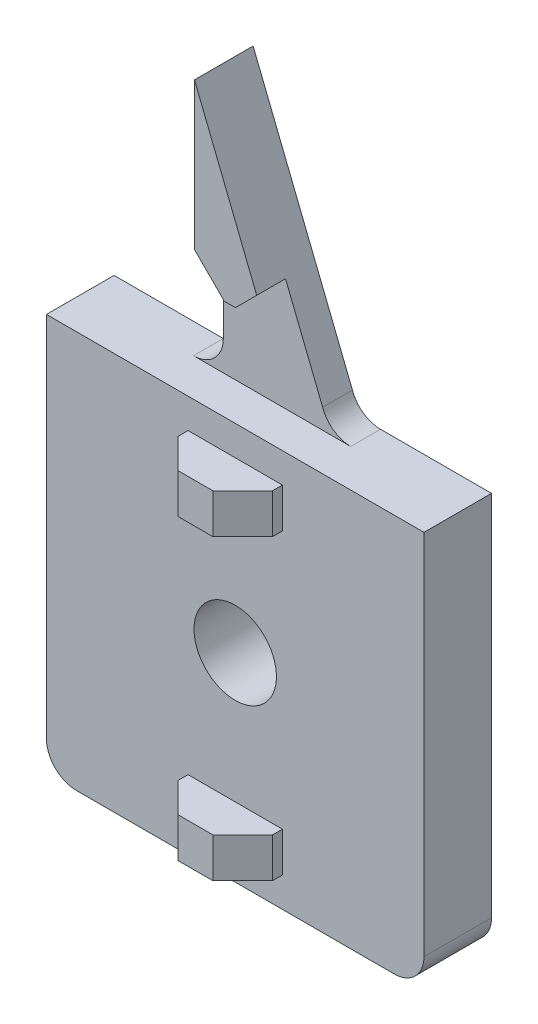
from build123d import *
from OCP.BRepFilletAPI import BRepFilletAPI_MakeChamfer

# Parameters (mm, degrees)
BOSS_EXTRUDE1_DEPTH      = 3.8
BOSS_EXTRUDE1_DEPTH_BACK = 3
SKETCH1_W                = 38
SKETCH1_H                = 40
SKETCH1_R                = 4.15
BOSS_EXTRUDE2_DEPTH      = 3
FILLET1_R                = 3
SKETCH3_W                = 9.5
SKETCH3_H                = 4
BOSS_EXTRUDE3_DEPTH      = 4
BOSS_EXTRUDE4_DEPTH      = 2.9
CHAMFER1_SIZE            = 3
CHAMFER1_SIZE2           = 2.307927774


with BuildPart() as part:
    # Sketch1 → Boss-Extrude1 (new, two sides: drawn at the far end of the back side and taken through both)
    with BuildSketch(Plane.XY.offset(-BOSS_EXTRUDE1_DEPTH_BACK)):
        Rectangle(SKETCH1_W, SKETCH1_H)
        with Locations(Location((0, 0, 0), (0, 0, 180))):
            Circle(SKETCH1_R, mode=Mode.SUBTRACT)
    extrude(amount=BOSS_EXTRUDE1_DEPTH + BOSS_EXTRUDE1_DEPTH_BACK)

    # Sketch2 → Boss-Extrude2 (add)
    with BuildSketch(Plane.XY):
        Polygon((5, 20), (5, 22), (-5, 47), (-5, 20), align=None)
    extrude(amount=-BOSS_EXTRUDE2_DEPTH)

    # Fillet1
    # the kernel refuses this fillet: 3 mm, written as the material it adds along each edge
    with BuildSketch(Plane(origin=(-5, 20, 0), x_dir=(-1, 0, 0), z_dir=(0, 0, -1))) as fillet1_piece_1:
        with BuildLine():
            CenterArc((FILLET1_R, FILLET1_R), FILLET1_R, 180, 90)
            Line((0, FILLET1_R), (0, 0))
            Line((0, 0), (FILLET1_R, 0))
        make_face()
    extrude(amount=3)
    with BuildSketch(Plane(origin=(5, 20, 0), x_dir=(1, 0, 0), z_dir=(0, 0, -1))) as fillet1_piece_2:
        with BuildLine():
            CenterArc((2.828427125, -3), FILLET1_R, 90, 70.528779366)
            Line((0, -2), (0, 0))
            Line((0, 0), (2.828427125, 0))
        make_face()
    extrude(amount=3)
    # the kernel refuses this fillet: 3 mm, written as the material it takes off along each edge
    with BuildSketch(Plane(origin=(19, -20, -10.5), x_dir=(-1, 0, 0), z_dir=(0, 0, 1)), Plane(origin=(-19, -20, 11.3), x_dir=(1, 0, 0), z_dir=(0, 0, -1))) as fillet1_2_piece_1:
        with BuildLine():
            CenterArc((FILLET1_R, -FILLET1_R), FILLET1_R, 90, 90)
            Line((0, -FILLET1_R), (0, 0))
            Line((0, 0), (FILLET1_R, 0))
        make_face()
    extrude(amount=21.8, mode=Mode.SUBTRACT)

    # Sketch3 → Boss-Extrude3 (add)
    with BuildSketch(Plane.XY.offset(3.8)):
        with Locations((0, -15)):
            Rectangle(SKETCH3_W, SKETCH3_H)
        with Locations((0, 15)):
            Rectangle(SKETCH3_W, SKETCH3_H)
    extrude(amount=BOSS_EXTRUDE3_DEPTH)

    # Sketch4 → Boss-Extrude4 (add)
    with BuildSketch(Plane.XY):
        Polygon((-5, 29.2), (2.12, 29.2), (-5, 47), align=None)
    extrude(amount=BOSS_EXTRUDE4_DEPTH)

    # Chamfer1: one chamfer whose edges measure the first distance from different faces: ONE call of the kernel's chamfer builder (chamfer() names one face for all edges)
    chamfer1_edges_1 = [part.edges().sort_by_distance(p)[0] for p in [
        (-5, 29.2, 1.45),
        (4.75, 15, 7.8),
        (-4.75, 15, 7.8),
        (4.75, -15, 7.8),
        (-4.75, -15, 7.8),
    ]]
    chamfer1_edges_2 = [part.edges().sort_by_distance(p)[0] for p in [
        (2.12, 29.2, 1.45),
    ]]
    chamfer1_side_2 = [part.faces().sort_by_distance(p)[0] for p in [
        (-1.44, 29.2, 1.45),
    ]]
    chamfer1 = BRepFilletAPI_MakeChamfer(part.part.solid().wrapped)
    for e in chamfer1_edges_1:
        chamfer1.Add(CHAMFER1_SIZE, e.wrapped)
    for e in chamfer1_edges_2:
        chamfer1.Add(CHAMFER1_SIZE, CHAMFER1_SIZE2, e.wrapped, chamfer1_side_2[0].wrapped)  # the first distance lies on this face
    add(Compound.cast(chamfer1.Shape()), mode=Mode.REPLACE)


solid = part.part
